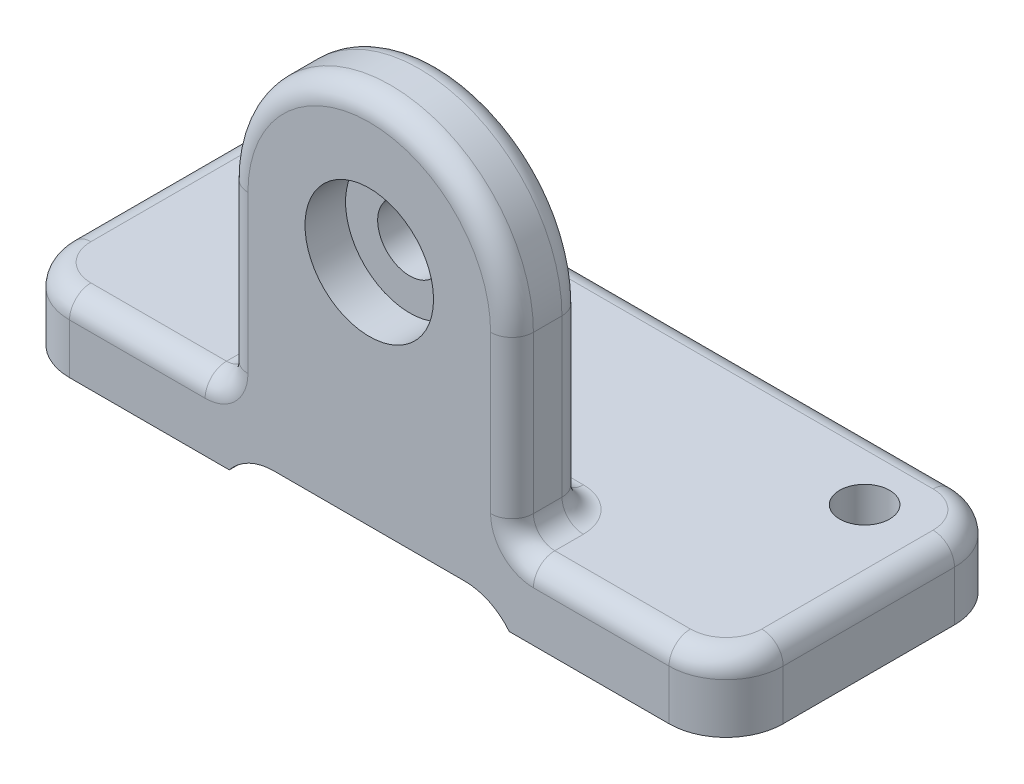
from build123d import *

# Parameters (mm, degrees)
ESBO_O1_W                                            = 100
ESBO_O1_H                                            = 40
BASEPLATE_DEPTH                                      = 10
VERTBOSS_DEPTH                                       = 10
ESBO_O3_W                                            = 39.225392784
ESBO_O3_H                                            = 3
BOTTOMSLOT_DEPTH                                     = 121.933866224
REBAIXO_PARA_PARAFUSO_DE_CABE_A_SEXTAVAD_D           = 9
REBAIXO_PARA_PARAFUSO_DE_CABE_A_SEXTAVAD_CBORE_D     = 18.01
REBAIXO_PARA_PARAFUSO_DE_CABE_A_SEXTAVAD_CBORE_DEPTH = 5.68
FILETE1_R                                            = 8
FILETE2_R                                            = 3
FURO_DE_DI_METRO_7_0_7_2_D                           = 7


with BuildPart() as part:
    # Esboço1 → BasePlate (new body)
    with BuildSketch(Plane(origin=(0, 0, 0), x_dir=(1, 0, 0), z_dir=(0, 1, 0))):
        with Locations((50, 20)):
            Rectangle(ESBO_O1_W, ESBO_O1_H)
    extrude(amount=BASEPLATE_DEPTH)

    # Esboço2 → VertBoss (add)
    with BuildSketch(Plane.XY):
        with BuildLine():
            Line((30, 0), (30, 35))
            ThreePointArc((30, 35), (50, 55), (70, 35))
            Line((70, 35), (70, 0))
            Line((70, 0), (30, 0))
        make_face()
    extrude(amount=-VERTBOSS_DEPTH)

    # Esboço3 → BottomSlot (cut, through all)
    with BuildSketch(Plane.XY):
        with Locations((50, 1.5)):
            Rectangle(ESBO_O3_W, ESBO_O3_H)
    extrude(amount=-BOTTOMSLOT_DEPTH, mode=Mode.SUBTRACT)

    # Rebaixo para parafuso de cabeça sextavada de M81 (through all)
    with Locations(Plane.XY):
        with Locations((50, 35)):
            CounterBoreHole(REBAIXO_PARA_PARAFUSO_DE_CABE_A_SEXTAVAD_D / 2, REBAIXO_PARA_PARAFUSO_DE_CABE_A_SEXTAVAD_CBORE_D / 2, REBAIXO_PARA_PARAFUSO_DE_CABE_A_SEXTAVAD_CBORE_DEPTH)

    # Filete1
    # the kernel refuses this fillet: 8 mm, written as the material it adds along each edge
    with BuildSketch(Plane(origin=(69.612696392, 3, 0), x_dir=(-1, 0, 0), z_dir=(0, 0, -1))) as filete1_piece_1:
        with BuildLine():
            CenterArc((6.244997998, -8), FILETE1_R, 90, 51.317812547)
            Line((0, -3), (0, 0))
            Line((0, 0), (6.244997998, 0))
        make_face()
    extrude(amount=40)
    with BuildSketch(Plane(origin=(30.387303608, 3, 0), x_dir=(0, -1, 0), z_dir=(0, 0, -1))) as filete1_piece_2:
        with BuildLine():
            CenterArc((8, -6.244997998), FILETE1_R, 128.682187453, 51.317812547)
            Line((0, -6.244997998), (0, 0))
            Line((0, 0), (3, 0))
        make_face()
    extrude(amount=40)
    # the kernel refuses this fillet: 8 mm, written as the material it takes off along each edge
    with BuildSketch(Plane(origin=(0, -20, -40), x_dir=(0, 0, 1), z_dir=(0, 1, 0)), Plane(origin=(0, -20, 0), x_dir=(1, 0, 0), z_dir=(0, 1, 0))) as filete1_2_piece_1:
        with BuildLine():
            CenterArc((FILETE1_R, FILETE1_R), FILETE1_R, 180, 90)
            Line((0, FILETE1_R), (0, 0))
            Line((0, 0), (FILETE1_R, 0))
        make_face()
    extrude(amount=50, mode=Mode.SUBTRACT)
    with BuildSketch(Plane(origin=(100, -20, 0), x_dir=(-1, 0, 0), z_dir=(0, 1, 0)), Plane(origin=(100, -20, -40), x_dir=(0, 0, 1), z_dir=(0, 1, 0))) as filete1_2_piece_2:
        with BuildLine():
            CenterArc((FILETE1_R, -FILETE1_R), FILETE1_R, 90, 90)
            Line((0, -FILETE1_R), (0, 0))
            Line((0, 0), (FILETE1_R, 0))
        make_face()
    extrude(amount=50, mode=Mode.SUBTRACT)

    # Filete2
    filete2_edges = [part.edges().sort_by_distance(p)[0] for p in [
        (81, 10, 0),
        (30, 22.5, -10),
        (70, 22.5, -10),
        (30, 22.5, 0),
        (70, 22.5, 0),
        (50, 55, 0),
        (30, 10, -5),
        (50, 55, -10),
        (70, 10, -5),
        (50, 10, -10),
        (0, 10, -20),
        (50, 10, -40),
        (19, 10, 0),
        (100, 10, -20),
        (2.343145751, 10, -2.343145751),
        (97.656854249, 10, -37.656854249),
        (97.656854249, 10, -2.343145751),
        (2.343145751, 10, -37.656854249),
    ]]
    fillet(filete2_edges, radius=FILETE2_R)

    # Furo de diâmetro Ø7.0 (7)2 (through all)
    with Locations(Plane(origin=(0, 10, 0), x_dir=(1, 0, 0), z_dir=(0, 1, 0))):
        with Locations((11.205655488, 30.291277502), (89.117630716, 30.291277502)):
            Hole(FURO_DE_DI_METRO_7_0_7_2_D / 2)


solid = part.part
